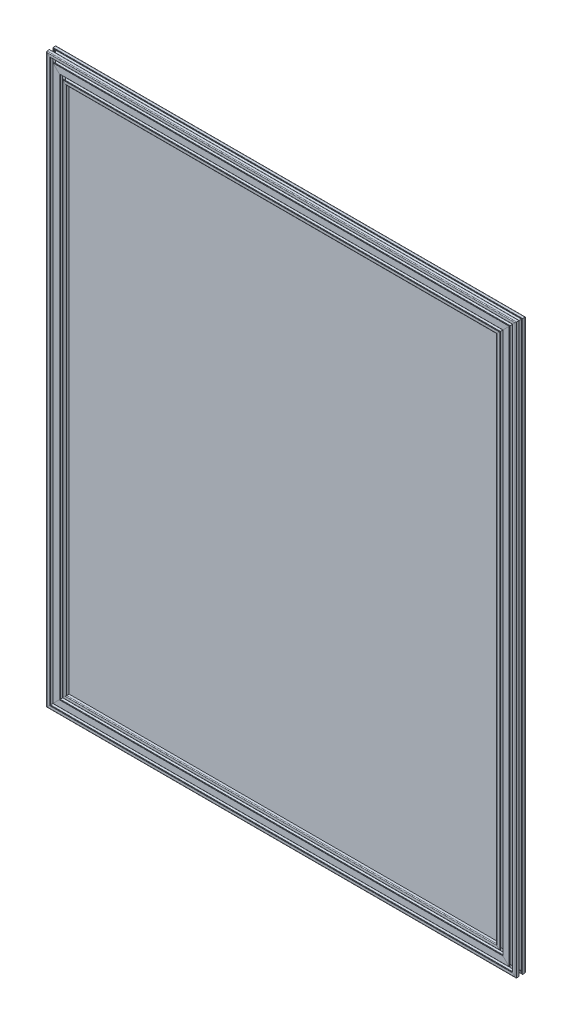
from build123d import *

# Parameters (mm, degrees)
F_20_X_40_X_R1_5_1_DEPTH      = 928.622776602
F_20_X_40_X_R1_5_1_DEPTH_BACK = 32.622776602
SKETCH1_R                     = 2.5
SKETCH1_ON_SEGMENT_2_R        = 2.5
F_20_X_40_X_R1_5_1_2_DEPTH    = 1161.745553203
SKETCH1_ON_SEGMENT_3_R        = 2.5
F_20_X_40_X_R1_5_1_3_DEPTH    = 961.245553203
SKETCH1_ON_SEGMENT_4_R        = 2.5
F_20_X_40_X_R1_5_1_4_DEPTH    = 1161.745553203
SKETCH_3_W                    = 896
SKETCH_3_H                    = 1096.5
SM_BASE_FLANGE_1_DEPTH        = 3


# Sheet-metal steps are written as plain solids
with BuildPart() as part:
    # Sketch1 → 铝型材 20 X 40 X R1.5(1) (new, two sides: drawn at the far end of the back side and taken through both)
    with BuildSketch(Plane(origin=(-448, -548.25, 0), x_dir=(0, 0, -1), z_dir=(1, 0, 0)).offset(-F_20_X_40_X_R1_5_1_DEPTH_BACK)):
        with BuildLine():
            Line((-3.6, 10), (-3.6, 9.5))
            Line((-3.6, 9.5), (-3.1, 9.5))
            Line((-3.1, 9.5), (-3.1, 8.5))
            Line((-3.1, 8.5), (-5.5, 8.5))
            Line((-5.5, 8.5), (-5.5, 6.65))
            Line((-5.5, 6.65), (-2.75, 3.9))
            Line((-2.75, 3.9), (2.75, 3.9))
            Line((2.75, 3.9), (5.5, 6.65))
            Line((5.5, 6.65), (5.5, 8.5))
            Line((5.5, 8.5), (3.1, 8.5))
            Line((3.1, 8.5), (3.1, 9.5))
            Line((3.1, 9.5), (3.6, 9.5))
            Line((3.6, 9.5), (3.6, 10))
            Line((3.6, 10), (8.5, 10))
            ThreePointArc((8.5, 10), (9.560660172, 9.560660172), (10, 8.5))
            Line((10, 8.5), (10, 3.6))
            Line((10, 3.6), (9.5, 3.6))
            Line((9.5, 3.6), (9.5, 3.1))
            Line((9.5, 3.1), (8.5, 3.1))
            Line((8.5, 3.1), (8.5, 5.5))
            Line((8.5, 5.5), (6.65, 5.5))
            Line((6.65, 5.5), (3.9, 2.75))
            Line((3.9, 2.75), (3.9, -2.75))
            Line((3.9, -2.75), (6.65, -5.5))
            Line((6.65, -5.5), (8.5, -5.5))
            Line((8.5, -5.5), (8.5, -3.1))
            Line((8.5, -3.1), (9.5, -3.1))
            Line((9.5, -3.1), (9.5, -3.6))
            Line((9.5, -3.6), (10, -3.6))
            Line((10, -3.6), (10, -16.4))
            Line((10, -16.4), (9.5, -16.4))
            Line((9.5, -16.4), (9.5, -16.9))
            Line((9.5, -16.9), (8.5, -16.9))
            Line((8.5, -16.9), (8.5, -14.5))
            Line((8.5, -14.5), (6.65, -14.5))
            Line((6.65, -14.5), (3.9, -17.25))
            Line((3.9, -17.25), (3.9, -22.75))
            Line((3.9, -22.75), (6.65, -25.5))
            Line((6.65, -25.5), (8.5, -25.5))
            Line((8.5, -25.5), (8.5, -23.1))
            Line((8.5, -23.1), (9.5, -23.1))
            Line((9.5, -23.1), (9.5, -23.6))
            Line((9.5, -23.6), (10, -23.6))
            Line((10, -23.6), (10, -28.5))
            ThreePointArc((10, -28.5), (9.560660172, -29.560660172), (8.5, -30))
            Line((8.5, -30), (3.6, -30))
            Line((3.6, -30), (3.6, -29.5))
            Line((3.6, -29.5), (3.1, -29.5))
            Line((3.1, -29.5), (3.1, -28.5))
            Line((3.1, -28.5), (5.5, -28.5))
            Line((5.5, -28.5), (5.5, -26.65))
            Line((5.5, -26.65), (2.75, -23.9))
            Line((2.75, -23.9), (-2.75, -23.9))
            Line((-2.75, -23.9), (-5.5, -26.65))
            Line((-5.5, -26.65), (-5.5, -28.5))
            Line((-5.5, -28.5), (-3.1, -28.5))
            Line((-3.1, -28.5), (-3.1, -29.5))
            Line((-3.1, -29.5), (-3.6, -29.5))
            Line((-3.6, -29.5), (-3.6, -30))
            Line((-3.6, -30), (-8.5, -30))
            ThreePointArc((-8.5, -30), (-9.560660172, -29.560660172), (-10, -28.5))
            Line((-10, -28.5), (-10, -23.6))
            Line((-10, -23.6), (-9.5, -23.6))
            Line((-9.5, -23.6), (-9.5, -23.1))
            Line((-9.5, -23.1), (-8.5, -23.1))
            Line((-8.5, -23.1), (-8.5, -25.5))
            Line((-8.5, -25.5), (-6.65, -25.5))
            Line((-6.65, -25.5), (-3.9, -22.75))
            Line((-3.9, -22.75), (-3.9, -17.25))
            Line((-3.9, -17.25), (-6.65, -14.5))
            Line((-6.65, -14.5), (-8.5, -14.5))
            Line((-8.5, -14.5), (-8.5, -16.9))
            Line((-8.5, -16.9), (-9.5, -16.9))
            Line((-9.5, -16.9), (-9.5, -16.4))
            Line((-9.5, -16.4), (-10, -16.4))
            Line((-10, -16.4), (-10, -3.6))
            Line((-10, -3.6), (-9.5, -3.6))
            Line((-9.5, -3.6), (-9.5, -3.1))
            Line((-9.5, -3.1), (-8.5, -3.1))
            Line((-8.5, -3.1), (-8.5, -5.5))
            Line((-8.5, -5.5), (-6.65, -5.5))
            Line((-6.65, -5.5), (-3.9, -2.75))
            Line((-3.9, -2.75), (-3.9, 2.75))
            Line((-3.9, 2.75), (-6.65, 5.5))
            Line((-6.65, 5.5), (-8.5, 5.5))
            Line((-8.5, 5.5), (-8.5, 3.1))
            Line((-8.5, 3.1), (-9.5, 3.1))
            Line((-9.5, 3.1), (-9.5, 3.6))
            Line((-9.5, 3.6), (-10, 3.6))
            Line((-10, 3.6), (-10, 8.5))
            ThreePointArc((-10, 8.5), (-9.560660172, 9.560660172), (-8.5, 10))
            Line((-8.5, 10), (-3.6, 10))
        make_face()
        Circle(SKETCH1_R, mode=Mode.SUBTRACT)
        with Locations((0, -20)):
            Circle(SKETCH1_R, mode=Mode.SUBTRACT)
        Polygon((8.85, -10), (2.75, -3.9), (-2.75, -3.9), (-8.85, -10), (-2.75, -16.1), (2.75, -16.1), align=None, mode=Mode.SUBTRACT)
    extrude(amount=F_20_X_40_X_R1_5_1_DEPTH + F_20_X_40_X_R1_5_1_DEPTH_BACK)

    # 铝型材 20 X 40 X R1.5(1) mitre 1
    split(bisect_by=Plane(origin=(-448, -548.25, 0), x_dir=(0.707106781, 0.707106781, 0), z_dir=(0.707106781, -0.707106781, 0)), keep=Keep.TOP)

    # 铝型材 20 X 40 X R1.5(1) mitre 2
    split(bisect_by=Plane(origin=(448, -548.25, 0), x_dir=(0.707106781, -0.707106781, 0), z_dir=(-0.707106781, -0.707106781, 0)), keep=Keep.TOP)


with BuildPart() as body_2:
    # Sketch1 on segment 2 (carried to segment 2) → 20 X 40 X R1.5_1 2 (new body)
    with BuildSketch(Plane(origin=(448, -580.872776602, 0), x_dir=(0, 0, -1), z_dir=(0, 1, 0))):
        with BuildLine():
            Line((-3.6, 10), (-3.6, 9.5))
            Line((-3.6, 9.5), (-3.1, 9.5))
            Line((-3.1, 9.5), (-3.1, 8.5))
            Line((-3.1, 8.5), (-5.5, 8.5))
            Line((-5.5, 8.5), (-5.5, 6.65))
            Line((-5.5, 6.65), (-2.75, 3.9))
            Line((-2.75, 3.9), (2.75, 3.9))
            Line((2.75, 3.9), (5.5, 6.65))
            Line((5.5, 6.65), (5.5, 8.5))
            Line((5.5, 8.5), (3.1, 8.5))
            Line((3.1, 8.5), (3.1, 9.5))
            Line((3.1, 9.5), (3.6, 9.5))
            Line((3.6, 9.5), (3.6, 10))
            Line((3.6, 10), (8.5, 10))
            ThreePointArc((8.5, 10), (9.560660172, 9.560660172), (10, 8.5))
            Line((10, 8.5), (10, 3.6))
            Line((10, 3.6), (9.5, 3.6))
            Line((9.5, 3.6), (9.5, 3.1))
            Line((9.5, 3.1), (8.5, 3.1))
            Line((8.5, 3.1), (8.5, 5.5))
            Line((8.5, 5.5), (6.65, 5.5))
            Line((6.65, 5.5), (3.9, 2.75))
            Line((3.9, 2.75), (3.9, -2.75))
            Line((3.9, -2.75), (6.65, -5.5))
            Line((6.65, -5.5), (8.5, -5.5))
            Line((8.5, -5.5), (8.5, -3.1))
            Line((8.5, -3.1), (9.5, -3.1))
            Line((9.5, -3.1), (9.5, -3.6))
            Line((9.5, -3.6), (10, -3.6))
            Line((10, -3.6), (10, -16.4))
            Line((10, -16.4), (9.5, -16.4))
            Line((9.5, -16.4), (9.5, -16.9))
            Line((9.5, -16.9), (8.5, -16.9))
            Line((8.5, -16.9), (8.5, -14.5))
            Line((8.5, -14.5), (6.65, -14.5))
            Line((6.65, -14.5), (3.9, -17.25))
            Line((3.9, -17.25), (3.9, -22.75))
            Line((3.9, -22.75), (6.65, -25.5))
            Line((6.65, -25.5), (8.5, -25.5))
            Line((8.5, -25.5), (8.5, -23.1))
            Line((8.5, -23.1), (9.5, -23.1))
            Line((9.5, -23.1), (9.5, -23.6))
            Line((9.5, -23.6), (10, -23.6))
            Line((10, -23.6), (10, -28.5))
            ThreePointArc((10, -28.5), (9.560660172, -29.560660172), (8.5, -30))
            Line((8.5, -30), (3.6, -30))
            Line((3.6, -30), (3.6, -29.5))
            Line((3.6, -29.5), (3.1, -29.5))
            Line((3.1, -29.5), (3.1, -28.5))
            Line((3.1, -28.5), (5.5, -28.5))
            Line((5.5, -28.5), (5.5, -26.65))
            Line((5.5, -26.65), (2.75, -23.9))
            Line((2.75, -23.9), (-2.75, -23.9))
            Line((-2.75, -23.9), (-5.5, -26.65))
            Line((-5.5, -26.65), (-5.5, -28.5))
            Line((-5.5, -28.5), (-3.1, -28.5))
            Line((-3.1, -28.5), (-3.1, -29.5))
            Line((-3.1, -29.5), (-3.6, -29.5))
            Line((-3.6, -29.5), (-3.6, -30))
            Line((-3.6, -30), (-8.5, -30))
            ThreePointArc((-8.5, -30), (-9.560660172, -29.560660172), (-10, -28.5))
            Line((-10, -28.5), (-10, -23.6))
            Line((-10, -23.6), (-9.5, -23.6))
            Line((-9.5, -23.6), (-9.5, -23.1))
            Line((-9.5, -23.1), (-8.5, -23.1))
            Line((-8.5, -23.1), (-8.5, -25.5))
            Line((-8.5, -25.5), (-6.65, -25.5))
            Line((-6.65, -25.5), (-3.9, -22.75))
            Line((-3.9, -22.75), (-3.9, -17.25))
            Line((-3.9, -17.25), (-6.65, -14.5))
            Line((-6.65, -14.5), (-8.5, -14.5))
            Line((-8.5, -14.5), (-8.5, -16.9))
            Line((-8.5, -16.9), (-9.5, -16.9))
            Line((-9.5, -16.9), (-9.5, -16.4))
            Line((-9.5, -16.4), (-10, -16.4))
            Line((-10, -16.4), (-10, -3.6))
            Line((-10, -3.6), (-9.5, -3.6))
            Line((-9.5, -3.6), (-9.5, -3.1))
            Line((-9.5, -3.1), (-8.5, -3.1))
            Line((-8.5, -3.1), (-8.5, -5.5))
            Line((-8.5, -5.5), (-6.65, -5.5))
            Line((-6.65, -5.5), (-3.9, -2.75))
            Line((-3.9, -2.75), (-3.9, 2.75))
            Line((-3.9, 2.75), (-6.65, 5.5))
            Line((-6.65, 5.5), (-8.5, 5.5))
            Line((-8.5, 5.5), (-8.5, 3.1))
            Line((-8.5, 3.1), (-9.5, 3.1))
            Line((-9.5, 3.1), (-9.5, 3.6))
            Line((-9.5, 3.6), (-10, 3.6))
            Line((-10, 3.6), (-10, 8.5))
            ThreePointArc((-10, 8.5), (-9.560660172, 9.560660172), (-8.5, 10))
            Line((-8.5, 10), (-3.6, 10))
        make_face()
        Circle(SKETCH1_ON_SEGMENT_2_R, mode=Mode.SUBTRACT)
        with Locations((0, -20)):
            Circle(SKETCH1_ON_SEGMENT_2_R, mode=Mode.SUBTRACT)
        Polygon((8.85, -10), (2.75, -3.9), (-2.75, -3.9), (-8.85, -10), (-2.75, -16.1), (2.75, -16.1), align=None, mode=Mode.SUBTRACT)
    extrude(amount=F_20_X_40_X_R1_5_1_2_DEPTH)

    # 20 X 40 X R1.5_1 2 mitre 1
    split(bisect_by=Plane(origin=(448, 548.25, 0), x_dir=(0.707106781, 0.707106781, 0), z_dir=(0.707106781, -0.707106781, 0)), keep=Keep.TOP)

    # 20 X 40 X R1.5_1 2 mitre 2
    split(bisect_by=Plane(origin=(448, -548.25, 0), x_dir=(-0.707106781, 0.707106781, 0), z_dir=(0.707106781, 0.707106781, 0)), keep=Keep.TOP)


with BuildPart() as body_3:
    # Sketch1 on segment 3 (carried to segment 3) → 20 X 40 X R1.5_1 3 (new body)
    with BuildSketch(Plane(origin=(480.622776602, 548.25, 0), x_dir=(0, 0, -1), z_dir=(-1, 0, 0))):
        with BuildLine():
            Line((-3.6, 10), (-3.6, 9.5))
            Line((-3.6, 9.5), (-3.1, 9.5))
            Line((-3.1, 9.5), (-3.1, 8.5))
            Line((-3.1, 8.5), (-5.5, 8.5))
            Line((-5.5, 8.5), (-5.5, 6.65))
            Line((-5.5, 6.65), (-2.75, 3.9))
            Line((-2.75, 3.9), (2.75, 3.9))
            Line((2.75, 3.9), (5.5, 6.65))
            Line((5.5, 6.65), (5.5, 8.5))
            Line((5.5, 8.5), (3.1, 8.5))
            Line((3.1, 8.5), (3.1, 9.5))
            Line((3.1, 9.5), (3.6, 9.5))
            Line((3.6, 9.5), (3.6, 10))
            Line((3.6, 10), (8.5, 10))
            ThreePointArc((8.5, 10), (9.560660172, 9.560660172), (10, 8.5))
            Line((10, 8.5), (10, 3.6))
            Line((10, 3.6), (9.5, 3.6))
            Line((9.5, 3.6), (9.5, 3.1))
            Line((9.5, 3.1), (8.5, 3.1))
            Line((8.5, 3.1), (8.5, 5.5))
            Line((8.5, 5.5), (6.65, 5.5))
            Line((6.65, 5.5), (3.9, 2.75))
            Line((3.9, 2.75), (3.9, -2.75))
            Line((3.9, -2.75), (6.65, -5.5))
            Line((6.65, -5.5), (8.5, -5.5))
            Line((8.5, -5.5), (8.5, -3.1))
            Line((8.5, -3.1), (9.5, -3.1))
            Line((9.5, -3.1), (9.5, -3.6))
            Line((9.5, -3.6), (10, -3.6))
            Line((10, -3.6), (10, -16.4))
            Line((10, -16.4), (9.5, -16.4))
            Line((9.5, -16.4), (9.5, -16.9))
            Line((9.5, -16.9), (8.5, -16.9))
            Line((8.5, -16.9), (8.5, -14.5))
            Line((8.5, -14.5), (6.65, -14.5))
            Line((6.65, -14.5), (3.9, -17.25))
            Line((3.9, -17.25), (3.9, -22.75))
            Line((3.9, -22.75), (6.65, -25.5))
            Line((6.65, -25.5), (8.5, -25.5))
            Line((8.5, -25.5), (8.5, -23.1))
            Line((8.5, -23.1), (9.5, -23.1))
            Line((9.5, -23.1), (9.5, -23.6))
            Line((9.5, -23.6), (10, -23.6))
            Line((10, -23.6), (10, -28.5))
            ThreePointArc((10, -28.5), (9.560660172, -29.560660172), (8.5, -30))
            Line((8.5, -30), (3.6, -30))
            Line((3.6, -30), (3.6, -29.5))
            Line((3.6, -29.5), (3.1, -29.5))
            Line((3.1, -29.5), (3.1, -28.5))
            Line((3.1, -28.5), (5.5, -28.5))
            Line((5.5, -28.5), (5.5, -26.65))
            Line((5.5, -26.65), (2.75, -23.9))
            Line((2.75, -23.9), (-2.75, -23.9))
            Line((-2.75, -23.9), (-5.5, -26.65))
            Line((-5.5, -26.65), (-5.5, -28.5))
            Line((-5.5, -28.5), (-3.1, -28.5))
            Line((-3.1, -28.5), (-3.1, -29.5))
            Line((-3.1, -29.5), (-3.6, -29.5))
            Line((-3.6, -29.5), (-3.6, -30))
            Line((-3.6, -30), (-8.5, -30))
            ThreePointArc((-8.5, -30), (-9.560660172, -29.560660172), (-10, -28.5))
            Line((-10, -28.5), (-10, -23.6))
            Line((-10, -23.6), (-9.5, -23.6))
            Line((-9.5, -23.6), (-9.5, -23.1))
            Line((-9.5, -23.1), (-8.5, -23.1))
            Line((-8.5, -23.1), (-8.5, -25.5))
            Line((-8.5, -25.5), (-6.65, -25.5))
            Line((-6.65, -25.5), (-3.9, -22.75))
            Line((-3.9, -22.75), (-3.9, -17.25))
            Line((-3.9, -17.25), (-6.65, -14.5))
            Line((-6.65, -14.5), (-8.5, -14.5))
            Line((-8.5, -14.5), (-8.5, -16.9))
            Line((-8.5, -16.9), (-9.5, -16.9))
            Line((-9.5, -16.9), (-9.5, -16.4))
            Line((-9.5, -16.4), (-10, -16.4))
            Line((-10, -16.4), (-10, -3.6))
            Line((-10, -3.6), (-9.5, -3.6))
            Line((-9.5, -3.6), (-9.5, -3.1))
            Line((-9.5, -3.1), (-8.5, -3.1))
            Line((-8.5, -3.1), (-8.5, -5.5))
            Line((-8.5, -5.5), (-6.65, -5.5))
            Line((-6.65, -5.5), (-3.9, -2.75))
            Line((-3.9, -2.75), (-3.9, 2.75))
            Line((-3.9, 2.75), (-6.65, 5.5))
            Line((-6.65, 5.5), (-8.5, 5.5))
            Line((-8.5, 5.5), (-8.5, 3.1))
            Line((-8.5, 3.1), (-9.5, 3.1))
            Line((-9.5, 3.1), (-9.5, 3.6))
            Line((-9.5, 3.6), (-10, 3.6))
            Line((-10, 3.6), (-10, 8.5))
            ThreePointArc((-10, 8.5), (-9.560660172, 9.560660172), (-8.5, 10))
            Line((-8.5, 10), (-3.6, 10))
        make_face()
        Circle(SKETCH1_ON_SEGMENT_3_R, mode=Mode.SUBTRACT)
        with Locations((0, -20)):
            Circle(SKETCH1_ON_SEGMENT_3_R, mode=Mode.SUBTRACT)
        Polygon((8.85, -10), (2.75, -3.9), (-2.75, -3.9), (-8.85, -10), (-2.75, -16.1), (2.75, -16.1), align=None, mode=Mode.SUBTRACT)
    extrude(amount=F_20_X_40_X_R1_5_1_3_DEPTH)

    # 20 X 40 X R1.5_1 3 mitre 1
    split(bisect_by=Plane(origin=(-448, 548.25, 0), x_dir=(-0.707106781, 0.707106781, 0), z_dir=(0.707106781, 0.707106781, 0)), keep=Keep.TOP)

    # 20 X 40 X R1.5_1 3 mitre 2
    split(bisect_by=Plane(origin=(448, 548.25, 0), x_dir=(-0.707106781, -0.707106781, 0), z_dir=(-0.707106781, 0.707106781, 0)), keep=Keep.TOP)


with BuildPart() as body_4:
    # Sketch1 on segment 4 (carried to segment 4) → 20 X 40 X R1.5_1 4 (new body)
    with BuildSketch(Plane(origin=(-448, 580.872776602, 0), x_dir=(0, 0, -1), z_dir=(0, -1, 0))):
        with BuildLine():
            Line((-3.6, 10), (-3.6, 9.5))
            Line((-3.6, 9.5), (-3.1, 9.5))
            Line((-3.1, 9.5), (-3.1, 8.5))
            Line((-3.1, 8.5), (-5.5, 8.5))
            Line((-5.5, 8.5), (-5.5, 6.65))
            Line((-5.5, 6.65), (-2.75, 3.9))
            Line((-2.75, 3.9), (2.75, 3.9))
            Line((2.75, 3.9), (5.5, 6.65))
            Line((5.5, 6.65), (5.5, 8.5))
            Line((5.5, 8.5), (3.1, 8.5))
            Line((3.1, 8.5), (3.1, 9.5))
            Line((3.1, 9.5), (3.6, 9.5))
            Line((3.6, 9.5), (3.6, 10))
            Line((3.6, 10), (8.5, 10))
            ThreePointArc((8.5, 10), (9.560660172, 9.560660172), (10, 8.5))
            Line((10, 8.5), (10, 3.6))
            Line((10, 3.6), (9.5, 3.6))
            Line((9.5, 3.6), (9.5, 3.1))
            Line((9.5, 3.1), (8.5, 3.1))
            Line((8.5, 3.1), (8.5, 5.5))
            Line((8.5, 5.5), (6.65, 5.5))
            Line((6.65, 5.5), (3.9, 2.75))
            Line((3.9, 2.75), (3.9, -2.75))
            Line((3.9, -2.75), (6.65, -5.5))
            Line((6.65, -5.5), (8.5, -5.5))
            Line((8.5, -5.5), (8.5, -3.1))
            Line((8.5, -3.1), (9.5, -3.1))
            Line((9.5, -3.1), (9.5, -3.6))
            Line((9.5, -3.6), (10, -3.6))
            Line((10, -3.6), (10, -16.4))
            Line((10, -16.4), (9.5, -16.4))
            Line((9.5, -16.4), (9.5, -16.9))
            Line((9.5, -16.9), (8.5, -16.9))
            Line((8.5, -16.9), (8.5, -14.5))
            Line((8.5, -14.5), (6.65, -14.5))
            Line((6.65, -14.5), (3.9, -17.25))
            Line((3.9, -17.25), (3.9, -22.75))
            Line((3.9, -22.75), (6.65, -25.5))
            Line((6.65, -25.5), (8.5, -25.5))
            Line((8.5, -25.5), (8.5, -23.1))
            Line((8.5, -23.1), (9.5, -23.1))
            Line((9.5, -23.1), (9.5, -23.6))
            Line((9.5, -23.6), (10, -23.6))
            Line((10, -23.6), (10, -28.5))
            ThreePointArc((10, -28.5), (9.560660172, -29.560660172), (8.5, -30))
            Line((8.5, -30), (3.6, -30))
            Line((3.6, -30), (3.6, -29.5))
            Line((3.6, -29.5), (3.1, -29.5))
            Line((3.1, -29.5), (3.1, -28.5))
            Line((3.1, -28.5), (5.5, -28.5))
            Line((5.5, -28.5), (5.5, -26.65))
            Line((5.5, -26.65), (2.75, -23.9))
            Line((2.75, -23.9), (-2.75, -23.9))
            Line((-2.75, -23.9), (-5.5, -26.65))
            Line((-5.5, -26.65), (-5.5, -28.5))
            Line((-5.5, -28.5), (-3.1, -28.5))
            Line((-3.1, -28.5), (-3.1, -29.5))
            Line((-3.1, -29.5), (-3.6, -29.5))
            Line((-3.6, -29.5), (-3.6, -30))
            Line((-3.6, -30), (-8.5, -30))
            ThreePointArc((-8.5, -30), (-9.560660172, -29.560660172), (-10, -28.5))
            Line((-10, -28.5), (-10, -23.6))
            Line((-10, -23.6), (-9.5, -23.6))
            Line((-9.5, -23.6), (-9.5, -23.1))
            Line((-9.5, -23.1), (-8.5, -23.1))
            Line((-8.5, -23.1), (-8.5, -25.5))
            Line((-8.5, -25.5), (-6.65, -25.5))
            Line((-6.65, -25.5), (-3.9, -22.75))
            Line((-3.9, -22.75), (-3.9, -17.25))
            Line((-3.9, -17.25), (-6.65, -14.5))
            Line((-6.65, -14.5), (-8.5, -14.5))
            Line((-8.5, -14.5), (-8.5, -16.9))
            Line((-8.5, -16.9), (-9.5, -16.9))
            Line((-9.5, -16.9), (-9.5, -16.4))
            Line((-9.5, -16.4), (-10, -16.4))
            Line((-10, -16.4), (-10, -3.6))
            Line((-10, -3.6), (-9.5, -3.6))
            Line((-9.5, -3.6), (-9.5, -3.1))
            Line((-9.5, -3.1), (-8.5, -3.1))
            Line((-8.5, -3.1), (-8.5, -5.5))
            Line((-8.5, -5.5), (-6.65, -5.5))
            Line((-6.65, -5.5), (-3.9, -2.75))
            Line((-3.9, -2.75), (-3.9, 2.75))
            Line((-3.9, 2.75), (-6.65, 5.5))
            Line((-6.65, 5.5), (-8.5, 5.5))
            Line((-8.5, 5.5), (-8.5, 3.1))
            Line((-8.5, 3.1), (-9.5, 3.1))
            Line((-9.5, 3.1), (-9.5, 3.6))
            Line((-9.5, 3.6), (-10, 3.6))
            Line((-10, 3.6), (-10, 8.5))
            ThreePointArc((-10, 8.5), (-9.560660172, 9.560660172), (-8.5, 10))
            Line((-8.5, 10), (-3.6, 10))
        make_face()
        Circle(SKETCH1_ON_SEGMENT_4_R, mode=Mode.SUBTRACT)
        with Locations((0, -20)):
            Circle(SKETCH1_ON_SEGMENT_4_R, mode=Mode.SUBTRACT)
        Polygon((8.85, -10), (2.75, -3.9), (-2.75, -3.9), (-8.85, -10), (-2.75, -16.1), (2.75, -16.1), align=None, mode=Mode.SUBTRACT)
    extrude(amount=F_20_X_40_X_R1_5_1_4_DEPTH)

    # 20 X 40 X R1.5_1 4 mitre 1
    split(bisect_by=Plane(origin=(-448, 548.25, 0), x_dir=(0.707106781, -0.707106781, 0), z_dir=(-0.707106781, -0.707106781, 0)), keep=Keep.TOP)

    # 20 X 40 X R1.5_1 4 mitre 2
    split(bisect_by=Plane(origin=(-448, -548.25, 0), x_dir=(-0.707106781, -0.707106781, 0), z_dir=(-0.707106781, 0.707106781, 0)), keep=Keep.TOP)


with BuildPart() as body_5:
    # 草图3 → 基体-法兰1 (new body)
    with BuildSketch(Plane.XY):
        Rectangle(SKETCH_3_W, SKETCH_3_H)
    extrude(amount=-SM_BASE_FLANGE_1_DEPTH)


solid = Compound([part.part, body_2.part, body_3.part, body_4.part, body_5.part])
